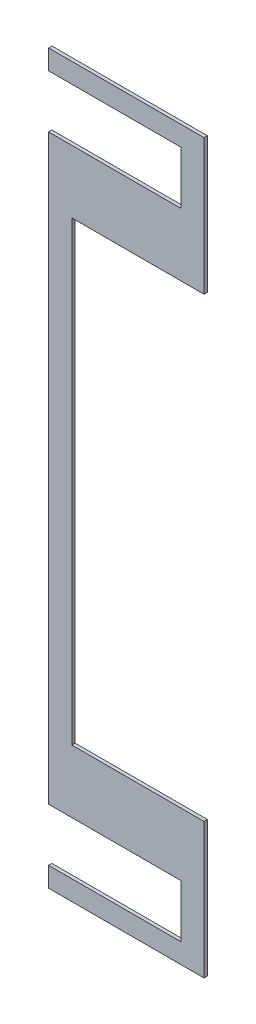
from build123d import *

# Parameters (mm, degrees)
BOSS_EXTRUDE1_DEPTH = 3.175


with BuildPart() as part:
    # Sketch1 → Boss-Extrude1 (new body)
    with BuildSketch(Plane(origin=(0, 0, 0), x_dir=(0, 1, 0), z_dir=(0, 0, 1))):
        Polygon((0, 0), (0, -149.225), (130.175, -149.225), (130.175, -22.225), (568.325, -22.225), (568.325, -149.225), (698.5, -149.225), (698.5, 0), (679.45, 0), (679.45, -127), (628.65, -127), (628.65, 0), (69.85, 0), (69.85, -127), (19.05, -127), (19.05, 0), align=None)
    extrude(amount=BOSS_EXTRUDE1_DEPTH)


solid = part.part
